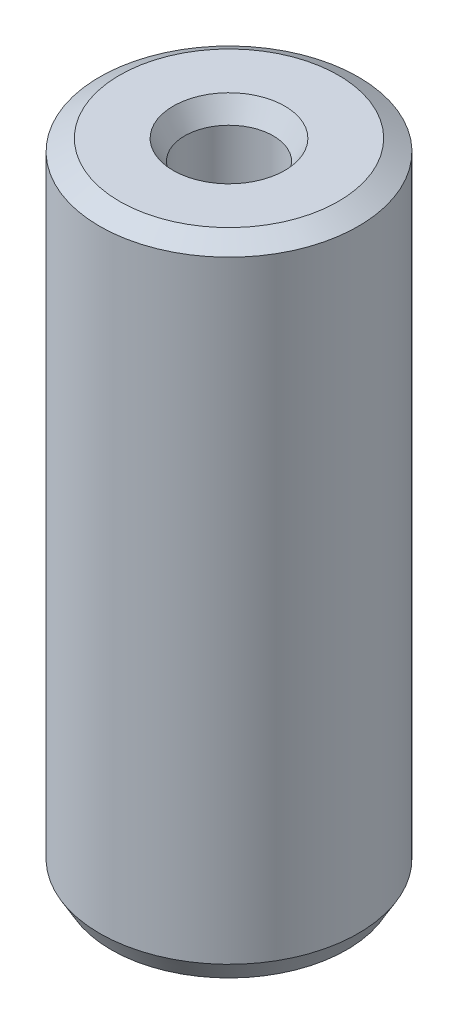
from build123d import *
from OCP.BRepFilletAPI import BRepFilletAPI_MakeChamfer

# Parameters (mm, degrees)
SKETCH1_R           = 5
BOSS_EXTRUDE1_DEPTH = 24.885067258
SKETCH2_R           = 1.710873151
CUT_EXTRUDE1_DEPTH  = 26.870186942
CHAMFER1_SIZE       = 0.445882896
CHAMFER1_SIZE2      = 0.772291829


with BuildPart() as part:
    # Sketch1 → Boss-Extrude1 (new body)
    with BuildSketch(Plane(origin=(0, 0, 0), x_dir=(1, 0, 0), z_dir=(0, 1, 0))):
        Circle(SKETCH1_R)
    extrude(amount=BOSS_EXTRUDE1_DEPTH)

    # Sketch2 → Cut-Extrude1 (cut, through all)
    with BuildSketch(Plane(origin=(0, 0, 0), x_dir=(1, 0, 0), z_dir=(0, 1, 0))):
        Circle(SKETCH2_R)
    extrude(amount=CUT_EXTRUDE1_DEPTH, mode=Mode.SUBTRACT)

    # Chamfer1: one chamfer whose edges measure the first distance from different faces: ONE call of the kernel's chamfer builder (chamfer() names one face for all edges)
    chamfer1_edges_1 = [part.edges().sort_by_distance(p)[0] for p in [
        (-1.710873151, 24.885067258, 0),
    ]]
    chamfer1_side_1 = [part.faces().sort_by_distance(p)[0] for p in [
        (-4.858578644, 24.885067258, 0),
    ]]
    chamfer1_edges_2 = [part.edges().sort_by_distance(p)[0] for p in [
        (-1.710873151, 0, 0),
    ]]
    chamfer1_side_2 = [part.faces().sort_by_distance(p)[0] for p in [
        (-1.710873151, 12.442533629, 0),
    ]]
    chamfer1_edges_3 = [part.edges().sort_by_distance(p)[0] for p in [
        (-5, 0, 0),
    ]]
    chamfer1_side_3 = [part.faces().sort_by_distance(p)[0] for p in [
        (-4.858578644, 0, 0),
    ]]
    chamfer1_edges_4 = [part.edges().sort_by_distance(p)[0] for p in [
        (-5, 24.885067258, 0),
    ]]
    chamfer1_side_4 = [part.faces().sort_by_distance(p)[0] for p in [
        (-5, 12.442533629, 0),
    ]]
    chamfer1 = BRepFilletAPI_MakeChamfer(part.part.solid().wrapped)
    for e in chamfer1_edges_1:
        chamfer1.Add(CHAMFER1_SIZE, CHAMFER1_SIZE2, e.wrapped, chamfer1_side_1[0].wrapped)  # the first distance lies on this face
    for e in chamfer1_edges_2:
        chamfer1.Add(CHAMFER1_SIZE, CHAMFER1_SIZE2, e.wrapped, chamfer1_side_2[0].wrapped)  # the first distance lies on this face
    for e in chamfer1_edges_3:
        chamfer1.Add(CHAMFER1_SIZE, CHAMFER1_SIZE2, e.wrapped, chamfer1_side_3[0].wrapped)  # the first distance lies on this face
    for e in chamfer1_edges_4:
        chamfer1.Add(CHAMFER1_SIZE, CHAMFER1_SIZE2, e.wrapped, chamfer1_side_4[0].wrapped)  # the first distance lies on this face
    add(Compound.cast(chamfer1.Shape()), mode=Mode.REPLACE)


solid = part.part
